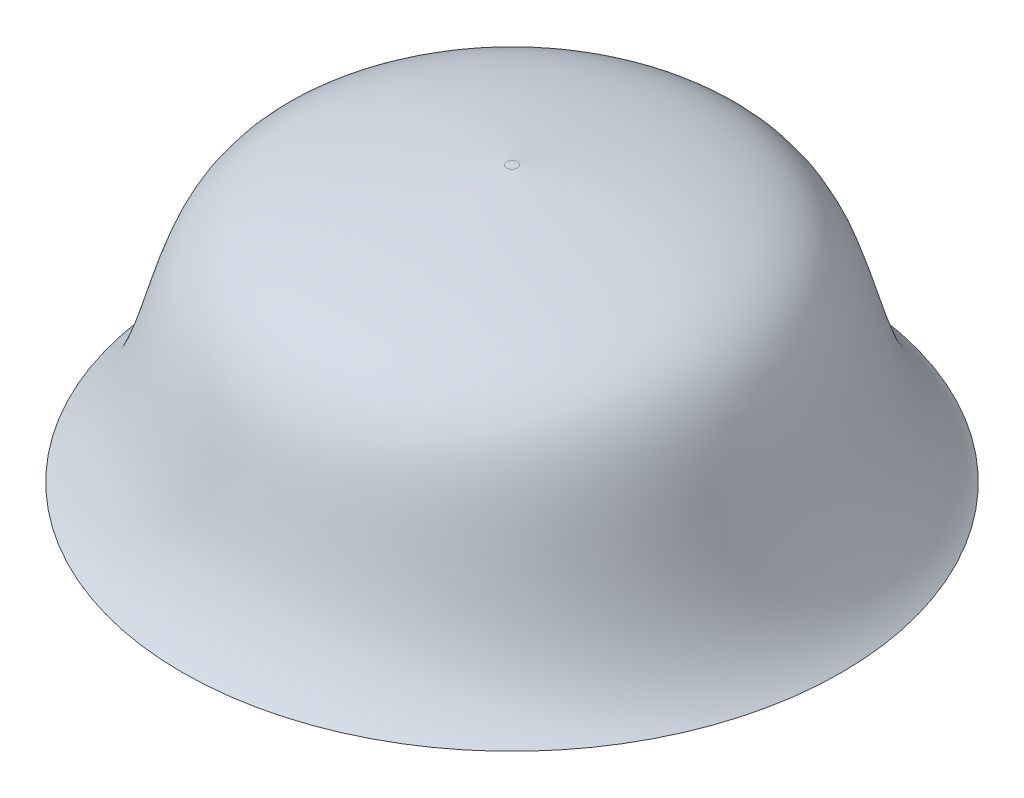
from build123d import *

# Parameters (mm, degrees)
SKETCH1_R           = 12
BOSS_EXTRUDE1_DEPTH = 10
SKETCH2_R           = 7
CUT_EXTRUDE1_DEPTH  = 7
SKETCH3_R           = 4.558249482
CUT_EXTRUDE2_DEPTH  = 2.5


# Read off the part's stored shape, not the designer's step: Cut-Revolve7
with BuildPart() as part:
    # Sketch1 → Boss-Extrude1 (new body)
    with BuildSketch(Plane(origin=(0, 0, 0), x_dir=(1, 0, 0), z_dir=(0, 1, 0))):
        with Locations(Location((0, 0, 0), (0, 0, 270))):
            Circle(SKETCH1_R)
    extrude(amount=BOSS_EXTRUDE1_DEPTH)

    # Sketch2 → Cut-Extrude1 (cut)
    with BuildSketch(Plane.XZ):
        with Locations(Location((0, 0, 0), (0, 0, 270))):
            Circle(SKETCH2_R)
        Polygon((2.95, -1.703183294), (2.95, 1.703183294), (0, 3.406366588), (-2.95, 1.703183294), (-2.95, -1.703183294), (0, -3.406366588), align=None, mode=Mode.SUBTRACT)
    extrude(amount=-CUT_EXTRUDE1_DEPTH, mode=Mode.SUBTRACT)

    # Sketch3 → Cut-Extrude2 (cut)
    with BuildSketch(Plane.XZ):
        Circle(SKETCH3_R)
    extrude(amount=-CUT_EXTRUDE2_DEPTH, mode=Mode.SUBTRACT)

    # Cut-Revolve7 outline → Cut-Revolve7 (revolve, cut)
    with BuildSketch(Plane.XY):
        with BuildLine():
            Line((12, 10), (0.197481425, 10))
            add(Edge.make_bspline(
                [(0.197481425, 10), (8.149812734, 9.330049938), (7.76948814, 8.0260799), (10.078601748, 8.379238452), (8.747465668, 2.511373283), (12, 0)],
                knots=[0, 0, 0, 0, 0, 0, 1, 1, 1, 1, 1, 1], degree=5))
            Line((12, 0), (12, 10))
        make_face()
    revolve(axis=Axis((0, 0, 0), (0, 1, 0)), mode=Mode.SUBTRACT)


solid = part.part
